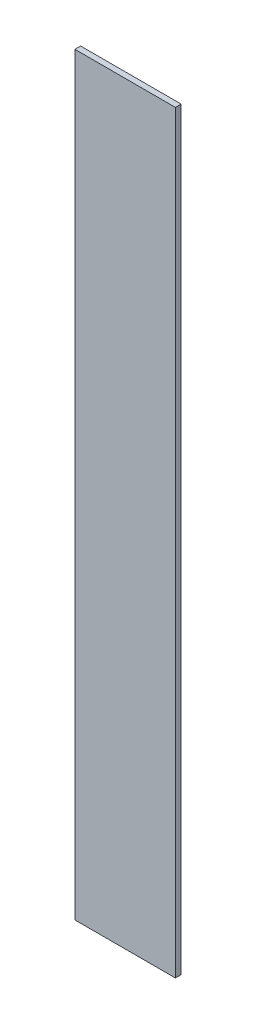
from build123d import *

# Parameters (mm, degrees)
SKETCH1_W           = 28
SKETCH1_H           = 210
BOSS_EXTRUDE1_DEPTH = 1.6


with BuildPart() as part:
    # Sketch1 → Boss-Extrude1 (new body)
    with BuildSketch(Plane.XY):
        with Locations((0, 105)):
            Rectangle(SKETCH1_W, SKETCH1_H)
    extrude(amount=BOSS_EXTRUDE1_DEPTH)


solid = part.part
